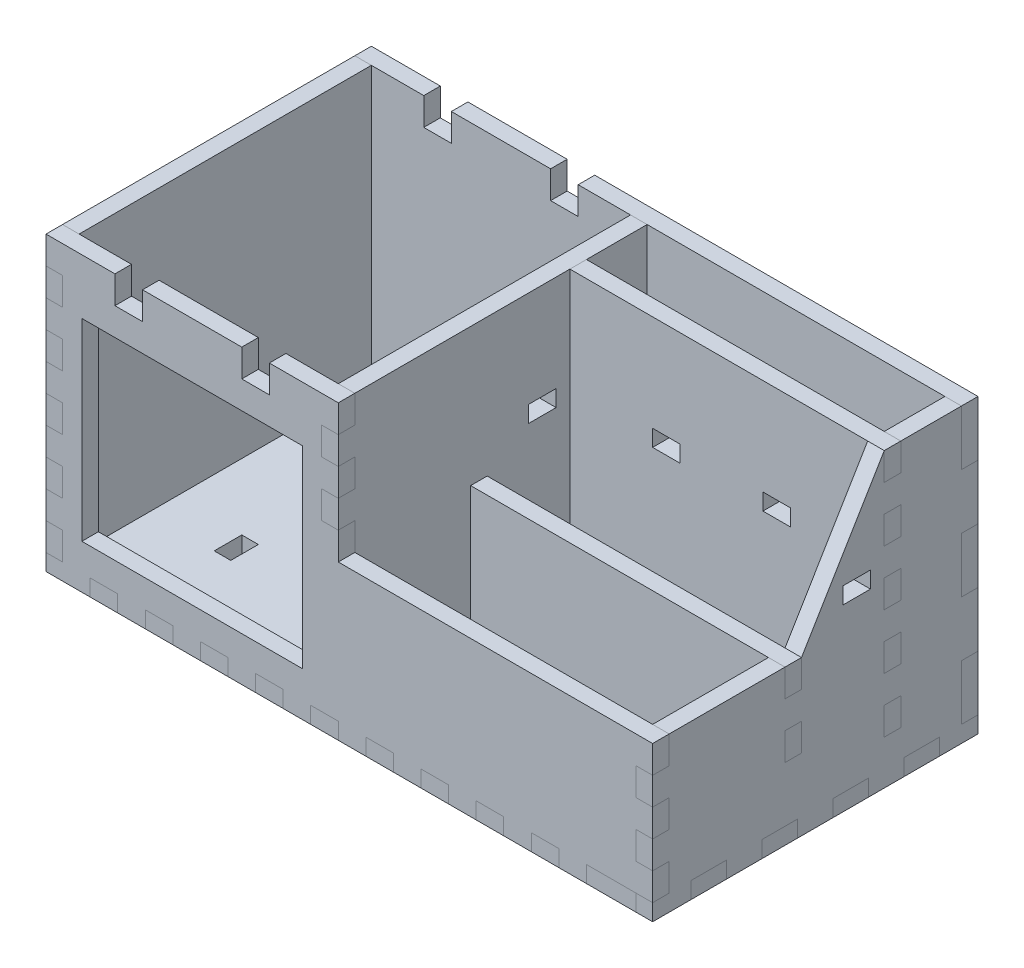
from build123d import *

# Parameters (mm, degrees)
SKETCH1_W              = 80
SKETCH1_H              = 70
BOSS_EXTRUDE1_DEPTH    = 6
SKETCH2_W              = 220
SKETCH2_H              = 118
BOSS_EXTRUDE2_DEPTH    = 6
BOSS_EXTRUDE9_DEPTH    = 6
BOSS_EXTRUDE11_DEPTH   = 6
BOSS_EXTRUDE13_DEPTH   = 6
BOSS_EXTRUDE14_DEPTH   = 6
CUT_EXTRUDE2_DEPTH     = 6
CUT_EXTRUDE1_DEPTH     = 6
CUT_EXTRUDE4_DEPTH     = 6
CUT_EXTRUDE5_DEPTH     = 6
CUT_EXTRUDE6_DEPTH     = 6
SKETCH26_W             = 108
SKETCH26_H             = 6
BOSS_EXTRUDE16_DEPTH   = 100
SKETCH28_W             = 6
SKETCH28_H             = 10
BOSS_EXTRUDE17_DEPTH   = 6
BOSS_EXTRUDE17_2_DEPTH = 6
BOSS_EXTRUDE17_3_DEPTH = 6
BOSS_EXTRUDE17_4_DEPTH = 6
BOSS_EXTRUDE17_5_DEPTH = 6
SKETCH29_W             = 6
SKETCH29_H             = 20
BOSS_EXTRUDE18_DEPTH   = 6
BOSS_EXTRUDE18_2_DEPTH = 6
SKETCH32_W             = 20
SKETCH32_H             = 6
BOSS_EXTRUDE19_DEPTH   = 6
BOSS_EXTRUDE19_2_DEPTH = 6
SKETCH34_W             = 108
SKETCH34_H             = 6
BOSS_EXTRUDE20_DEPTH   = 50
SKETCH39_W             = 6
SKETCH39_H             = 10
BOSS_EXTRUDE22_DEPTH   = 6
BOSS_EXTRUDE22_2_DEPTH = 6
SKETCH40_W             = 6
SKETCH40_H             = 20
BOSS_EXTRUDE23_DEPTH   = 6
SKETCH41_W             = 20
SKETCH41_H             = 6
BOSS_EXTRUDE24_DEPTH   = 6
BOSS_EXTRUDE24_2_DEPTH = 6
CUT_EXTRUDE9_DEPTH     = 6
SKETCH49_W             = 10
SKETCH49_H             = 6
CUT_EXTRUDE13_DEPTH    = 6
SKETCH51_W             = 10
SKETCH51_H             = 6
CUT_EXTRUDE15_DEPTH    = 6
SKETCH52_W             = 6
SKETCH52_H             = 10
CUT_EXTRUDE16_DEPTH    = 6
CUT_EXTRUDE17_DEPTH    = 6
SKETCH55_W             = 10
SKETCH55_H             = 6
CUT_EXTRUDE18_DEPTH    = 6


with BuildPart() as part:
    # Sketch1 → Boss-Extrude1 (new body)
    with BuildSketch(Plane.XY):
        Polygon((106, 106), (81, 106), (81, 96), (71, 96), (71, 106), (35, 106), (35, 96), (25, 96), (25, 106), (0, 106), (0, 96), (6, 96), (6, 86), (0, 86), (0, 76), (6, 76), (6, 66), (0, 66), (0, 56), (6, 56), (6, 46), (0, 46), (0, 36), (6, 36), (6, 26), (0, 26), (0, 16), (6, 16), (6, 6), (0, 6), (0, 0), (6, 0), (16, 0), (16, 6), (26, 6), (26, 0), (36, 0), (36, 6), (46, 6), (46, 0), (56, 0), (56, 6), (66, 6), (66, 0), (76, 0), (76, 6), (86, 6), (86, 0), (96, 0), (96, 6), (106, 6), (106, 0), (116, 0), (116, 6), (126, 6), (126, 0), (136, 0), (136, 6), (146, 6), (146, 0), (156, 0), (156, 6), (166, 6), (166, 0), (176, 0), (176, 6), (186, 6), (186, 0), (196, 0), (196, 6), (206, 6), (220, 6), (220, 16), (214, 16), (214, 26), (220, 26), (220, 36), (214, 36), (214, 46), (220, 46), (220, 56), (106, 56), (106, 66), (100, 66), (100, 76), (106, 76), (106, 86), (100, 86), (100, 96), (106, 96), align=None)
        with Locations((53, 51)):
            Rectangle(SKETCH1_W, SKETCH1_H, mode=Mode.SUBTRACT)
    extrude(amount=BOSS_EXTRUDE1_DEPTH)


with BuildPart() as body_2:
    # Sketch2 → Boss-Extrude2 (new body)
    with BuildSketch(Plane(origin=(0, 0, 0), x_dir=(1, 0, 0), z_dir=(0, 1, 0))):
        with Locations((110, 53)):
            Rectangle(SKETCH2_W, SKETCH2_H)
    extrude(amount=BOSS_EXTRUDE2_DEPTH)


with BuildPart() as body_3:
    # Sketch5 → Boss-Extrude9 (new body)
    with BuildSketch(Plane(origin=(0, 0, 0), x_dir=(0, 0, -1), z_dir=(1, 0, 0))):
        Polygon((-6, 106), (112, 106), (112, 6), (112, 0), (106, 0), (94.222222222, 0), (94.222222222, 6), (82.444444444, 6), (82.444444444, 0), (70.666666667, 0), (70.666666667, 6), (58.888888889, 6), (58.888888889, 0), (47.111111111, 0), (47.111111111, 6), (35.333333333, 6), (35.333333333, 0), (23.555555556, 0), (23.555555556, 6), (11.777777778, 6), (11.777777778, 0), (0, 0), (0, 6), (-6, 6), align=None)
    extrude(amount=BOSS_EXTRUDE9_DEPTH)


with BuildPart() as body_4:
    # Sketch11 → Boss-Extrude11 (new body)
    with BuildSketch(Plane(origin=(214, 0, 0), x_dir=(0, 0, -1), z_dir=(1, 0, 0))):
        Polygon((-6, 0), (0, 0), (8, 0), (8, 6), (20.857142857, 6), (20.857142857, 0), (33.714285714, 0), (33.714285714, 6), (46.571428571, 6), (46.571428571, 0), (59.428571429, 0), (59.428571429, 6), (72.285714286, 6), (72.285714286, 0), (85.142857143, 0), (85.142857143, 6), (98, 6), (98, 0), (112, 0), (112, 106), (78, 106), (48, 56), (-6, 56), (-6, 5.946592231), align=None)
    extrude(amount=BOSS_EXTRUDE11_DEPTH)


with BuildPart() as body_5:
    # Sketch15 → Boss-Extrude13 (new body)
    with BuildSketch(Plane(origin=(0, 0, -112), x_dir=(-1, 0, 0), z_dir=(0, 0, -1))):
        Polygon((-220, 106), (-81, 106), (-81, 96), (-71, 96), (-71, 106), (-35, 106), (-35, 96), (-25, 96), (-25, 106), (0, 106), (0, 86), (-6, 86), (-6, 66), (0, 66), (0, 46), (-6, 46), (-6, 26), (0, 26), (0, 6), (-6, 6), (-6, 0), (-24.909090909, 0), (-24.909090909, 6), (-43.818181818, 6), (-43.818181818, 0), (-62.727272727, 0), (-62.727272727, 6), (-81.636363636, 6), (-81.636363636, 0), (-100.545454545, 0), (-100.545454545, 6), (-119.454545455, 6), (-119.454545455, 0), (-138.363636364, 0), (-138.363636364, 6), (-157.272727273, 6), (-157.272727273, 0), (-176.181818182, 0), (-176.181818182, 6), (-195.090909091, 6), (-195.090909091, 0), (-214, 0), (-214, 6), (-220, 6), (-220, 26), (-214, 26), (-214, 46), (-220, 46), (-220, 66), (-214, 66), (-214, 86), (-220, 86), align=None)
    extrude(amount=-BOSS_EXTRUDE13_DEPTH)


with BuildPart() as body_6:
    # Sketch22 → Boss-Extrude14 (new body)
    with BuildSketch(Plane(origin=(100, 0, 0), x_dir=(0, 0, -1), z_dir=(1, 0, 0))):
        Polygon((-6, 106), (106, 106), (106, 86), (112, 86), (112, 66), (106, 66), (106, 46), (112, 46), (112, 26), (106, 26), (106, 6), (74, 6), (74, 0), (59, 0), (59, 6), (34, 6), (34, 0), (19, 0), (19, 6), (-6, 6), align=None)
    extrude(amount=BOSS_EXTRUDE14_DEPTH)


with BuildPart() as cut_extrude2_tool:
    # Sketch19 → Cut-Extrude2 (new body)
    with BuildSketch(Plane(origin=(0, 0, -112), x_dir=(-1, 0, 0), z_dir=(0, 0, -1))):
        Polygon((0, 86), (0, 106), (-25, 106), (-25, 96), (-35, 96), (-35, 106), (-71, 106), (-71, 96), (-81, 96), (-81, 106), (-220, 106), (-220, 86), (-214, 86), (-214, 66), (-220, 66), (-220, 46), (-214, 46), (-214, 26), (-220, 26), (-220, 6), (-214, 6), (-214, 0), (-195.090909091, 0), (-195.090909091, 6), (-176.181818182, 6), (-176.181818182, 0), (-157.272727273, 0), (-157.272727273, 6), (-138.363636364, 6), (-138.363636364, 0), (-119.454545455, 0), (-119.454545455, 6), (-100.545454545, 6), (-100.545454545, 0), (-81.636363636, 0), (-81.636363636, 6), (-62.727272727, 6), (-62.727272727, 0), (-43.818181818, 0), (-43.818181818, 6), (-24.909090909, 6), (-24.909090909, 0), (-6, 0), (-6, 6), (0, 6), (0, 26), (-6, 26), (-6, 46), (0, 46), (0, 66), (-6, 66), (-6, 86), align=None)
    extrude(amount=-CUT_EXTRUDE2_DEPTH)


with BuildPart() as body_4_1:
    add(body_4.part)

    # Cut-Extrude2: cut by cut_extrude2_tool
    add(cut_extrude2_tool.part, mode=Mode.SUBTRACT)


with BuildPart() as body_2_1:
    add(body_2.part)

    # Cut-Extrude2: cut by cut_extrude2_tool
    add(cut_extrude2_tool.part, mode=Mode.SUBTRACT)


with BuildPart() as body_3_1:
    add(body_3.part)

    # Cut-Extrude2: cut by cut_extrude2_tool
    add(cut_extrude2_tool.part, mode=Mode.SUBTRACT)


with BuildPart() as cut_extrude1_tool:
    # Sketch13 → Cut-Extrude1 (new body)
    with BuildSketch(Plane.XY.offset(6)):
        Polygon((0, 6), (0, 0), (16, 0), (16, 6), (26, 6), (26, 0), (36, 0), (36, 6), (46, 6), (46, 0), (56, 0), (56, 6), (66, 6), (66, 0), (76, 0), (76, 6), (86, 6), (86, 0), (96, 0), (96, 6), (106, 6), (106, 0), (116, 0), (116, 6), (126, 6), (126, 0), (136, 0), (136, 6), (146, 6), (146, 0), (156, 0), (156, 6), (166, 6), (166, 0), (176, 0), (176, 6), (186, 6), (186, 0), (196, 0), (196, 6), (220, 6), (220, 16), (214, 16), (214, 26), (220, 26), (220, 36), (214, 36), (214, 46), (220, 46), (220, 56), (106, 56), (106, 66), (100, 66), (100, 76), (106, 76), (106, 86), (100, 86), (100, 96), (106, 96), (106, 106), (81, 106), (81, 96), (71, 96), (71, 106), (35, 106), (35, 96), (25, 96), (25, 106), (0, 106), (0, 96), (6, 96), (6, 86), (0, 86), (0, 76), (6, 76), (6, 66), (0, 66), (0, 56), (6, 56), (6, 46), (0, 46), (0, 36), (6, 36), (6, 26), (0, 26), (0, 16), (6, 16), (6, 6), align=None)
    extrude(amount=-CUT_EXTRUDE1_DEPTH)


with BuildPart() as body_3_2:
    add(body_3_1.part)

    # Cut-Extrude1: cut by cut_extrude1_tool
    add(cut_extrude1_tool.part, mode=Mode.SUBTRACT)


with BuildPart() as body_2_2:
    add(body_2_1.part)

    # Cut-Extrude1: cut by cut_extrude1_tool
    add(cut_extrude1_tool.part, mode=Mode.SUBTRACT)

    # Sketch20 → Cut-Extrude4 (cut)
    with BuildSketch(Plane.ZY):
        Polygon((-112, 26), (-106, 26), (-106, 6), (-112, 6), (-112, 0), (-94.222222222, 0), (-94.222222222, 6), (-82.444444444, 6), (-82.444444444, 0), (-70.666666667, 0), (-70.666666667, 6), (-58.888888889, 6), (-58.888888889, 0), (-47.111111111, 0), (-47.111111111, 6), (-35.333333333, 6), (-35.333333333, 0), (-23.555555556, 0), (-23.555555556, 6), (-11.777777778, 6), (-11.777777778, 0), (0, 0), (0, 6), (6, 6), (6, 16), (0, 16), (0, 26), (6, 26), (6, 36), (0, 36), (0, 46), (6, 46), (6, 56), (0, 56), (0, 66), (6, 66), (6, 76), (0, 76), (0, 86), (6, 86), (6, 96), (0, 96), (0, 106), (-106, 106), (-106, 86), (-112, 86), (-112, 66), (-106, 66), (-106, 46), (-112, 46), align=None)
    extrude(amount=-CUT_EXTRUDE4_DEPTH, mode=Mode.SUBTRACT)

    # Sketch21 → Cut-Extrude5 (cut)
    with BuildSketch(Plane(origin=(220, 0, 0), x_dir=(0, 0, -1), z_dir=(1, 0, 0))):
        Polygon((112, 86), (106, 86), (106, 106), (78, 106), (48, 56), (0, 56), (0, 46), (-6, 46), (-6, 36), (0, 36), (0, 26), (-6, 26), (-6, 16), (0, 16), (0, 6), (-6, 6), (-6, 0), (8, 0), (8, 6), (20.857142857, 6), (20.857142857, 0), (33.714285714, 0), (33.714285714, 6), (46.571428571, 6), (46.571428571, 0), (59.428571429, 0), (59.428571429, 6), (72.285714286, 6), (72.285714286, 0), (85.142857143, 0), (85.142857143, 6), (98, 6), (98, 0), (112, 0), (112, 6), (106, 6), (106, 26), (112, 26), (112, 46), (106, 46), (106, 66), (112, 66), align=None)
    extrude(amount=-CUT_EXTRUDE5_DEPTH, mode=Mode.SUBTRACT)


with BuildPart() as body_4_2:
    add(body_4_1.part)

    # Cut-Extrude1: cut by cut_extrude1_tool
    add(cut_extrude1_tool.part, mode=Mode.SUBTRACT)


with BuildPart() as body_6_1:
    add(body_6.part)

    # Cut-Extrude1: cut by cut_extrude1_tool
    add(cut_extrude1_tool.part, mode=Mode.SUBTRACT)


with BuildPart() as cut_extrude6_tool:
    # Sketch23 → Cut-Extrude6 (new body)
    with BuildSketch(Plane(origin=(106, 0, 0), x_dir=(0, 0, -1), z_dir=(1, 0, 0))):
        Polygon((0, 96), (-6, 96), (-6, 86), (0, 86), (0, 76), (-6, 76), (-6, 66), (0, 66), (0, 6), (19, 6), (19, 0), (34, 0), (34, 6), (59, 6), (59, 0), (74, 0), (74, 6), (106, 6), (106, 26), (112, 26), (112, 46), (106, 46), (106, 66), (112, 66), (112, 86), (106, 86), (106, 106), (0, 106), align=None)
    extrude(amount=-CUT_EXTRUDE6_DEPTH)


with BuildPart() as body_2_3:
    add(body_2_2.part)

    # Cut-Extrude6: cut by cut_extrude6_tool
    add(cut_extrude6_tool.part, mode=Mode.SUBTRACT)


with BuildPart() as body_5_1:
    add(body_5.part)

    # Cut-Extrude6: cut by cut_extrude6_tool
    add(cut_extrude6_tool.part, mode=Mode.SUBTRACT)


with BuildPart() as body_7:
    # Sketch26 → Boss-Extrude16 (new body)
    with BuildSketch(Plane(origin=(0, 6, 0), x_dir=(1, 0, 0), z_dir=(0, 1, 0))):
        with Locations((160, 81)):
            Rectangle(SKETCH26_W, SKETCH26_H)
    extrude(amount=BOSS_EXTRUDE16_DEPTH)


with BuildPart() as body_8:
    # Sketch28 → Boss-Extrude17 (new body)
    with BuildSketch(Plane(origin=(214, 0, 0), x_dir=(0, 0, -1), z_dir=(1, 0, 0))):
        with Locations((81, 81)):
            Rectangle(SKETCH28_W, SKETCH28_H)
    extrude(amount=BOSS_EXTRUDE17_DEPTH)


with BuildPart() as body_9:
    # Sketch28 → Boss-Extrude17 2 (new body)
    with BuildSketch(Plane(origin=(214, 0, 0), x_dir=(0, 0, -1), z_dir=(1, 0, 0))):
        with Locations((81, 61)):
            Rectangle(SKETCH28_W, SKETCH28_H)
    extrude(amount=BOSS_EXTRUDE17_2_DEPTH)


with BuildPart() as body_10:
    # Sketch28 → Boss-Extrude17 3 (new body)
    with BuildSketch(Plane(origin=(214, 0, 0), x_dir=(0, 0, -1), z_dir=(1, 0, 0))):
        with Locations((81, 101)):
            Rectangle(SKETCH28_W, SKETCH28_H)
    extrude(amount=BOSS_EXTRUDE17_3_DEPTH)


with BuildPart() as body_11:
    # Sketch28 → Boss-Extrude17 4 (new body)
    with BuildSketch(Plane(origin=(214, 0, 0), x_dir=(0, 0, -1), z_dir=(1, 0, 0))):
        with Locations((81, 41)):
            Rectangle(SKETCH28_W, SKETCH28_H)
    extrude(amount=BOSS_EXTRUDE17_4_DEPTH)


with BuildPart() as body_12:
    # Sketch28 → Boss-Extrude17 5 (new body)
    with BuildSketch(Plane(origin=(214, 0, 0), x_dir=(0, 0, -1), z_dir=(1, 0, 0))):
        with Locations((81, 21)):
            Rectangle(SKETCH28_W, SKETCH28_H)
    extrude(amount=BOSS_EXTRUDE17_5_DEPTH)


with BuildPart() as body_7_1:
    add(body_7.part)

    # Combine1: union body 10, body 8, body 9, body 11, body 12
    add(body_10.part)
    add(body_8.part)
    add(body_9.part)
    add(body_11.part)
    add(body_12.part)


with BuildPart() as body_8_2:
    # Sketch29 → Boss-Extrude18 (new body)
    with BuildSketch(Plane.ZY.offset(-106)):
        with Locations((-81, 38.975792387)):
            Rectangle(SKETCH29_W, SKETCH29_H)
    extrude(amount=BOSS_EXTRUDE18_DEPTH)


with BuildPart() as body_9_2:
    # Sketch29 → Boss-Extrude18 2 (new body)
    with BuildSketch(Plane.ZY.offset(-106)):
        with Locations((-81, 82.881646171)):
            Rectangle(SKETCH29_W, SKETCH29_H)
    extrude(amount=BOSS_EXTRUDE18_2_DEPTH)


with BuildPart() as body_10_2:
    # Sketch32 → Boss-Extrude19 (new body)
    with BuildSketch(Plane.XZ.offset(-6)):
        with Locations((179.166556654, -81)):
            Rectangle(SKETCH32_W, SKETCH32_H)
    extrude(amount=BOSS_EXTRUDE19_DEPTH)


with BuildPart() as body_11_2:
    # Sketch32 → Boss-Extrude19 2 (new body)
    with BuildSketch(Plane.XZ.offset(-6)):
        with Locations((139.166556654, -81)):
            Rectangle(SKETCH32_W, SKETCH32_H)
    extrude(amount=BOSS_EXTRUDE19_2_DEPTH)

    # Combine3: union body 10 2, body 7, body 8 2
    add(body_10_2.part)
    add(body_7_1.part)
    add(body_8_2.part)

    # Sketch51 → Cut-Extrude15 (cut)
    with BuildSketch(Plane.XY.offset(-78)):
        with Locations((141, 68)):
            Rectangle(SKETCH51_W, SKETCH51_H)
        with Locations((181, 68)):
            Rectangle(SKETCH51_W, SKETCH51_H)
    extrude(amount=-CUT_EXTRUDE15_DEPTH, mode=Mode.SUBTRACT)


with BuildPart() as body_9_3:
    # Sketch34 → Boss-Extrude20 (new body)
    with BuildSketch(Plane(origin=(0, 6, 0), x_dir=(1, 0, 0), z_dir=(0, 1, 0))):
        with Locations((160, 45)):
            Rectangle(SKETCH34_W, SKETCH34_H)
    extrude(amount=BOSS_EXTRUDE20_DEPTH)


with BuildPart() as body_10_3:
    # Sketch39 → Boss-Extrude22 (new body)
    with BuildSketch(Plane(origin=(214, 0, 0), x_dir=(0, 0, -1), z_dir=(1, 0, 0))):
        with Locations((45, 51)):
            Rectangle(SKETCH39_W, SKETCH39_H)
    extrude(amount=BOSS_EXTRUDE22_DEPTH)


with BuildPart() as body_11_3:
    # Sketch39 → Boss-Extrude22 2 (new body)
    with BuildSketch(Plane(origin=(214, 0, 0), x_dir=(0, 0, -1), z_dir=(1, 0, 0))):
        with Locations((45, 31)):
            Rectangle(SKETCH39_W, SKETCH39_H)
    extrude(amount=BOSS_EXTRUDE22_2_DEPTH)


with BuildPart() as body_12_2:
    # Sketch40 → Boss-Extrude23 (new body)
    with BuildSketch(Plane.ZY.offset(-106)):
        with Locations((-45, 31)):
            Rectangle(SKETCH40_W, SKETCH40_H)
    extrude(amount=BOSS_EXTRUDE23_DEPTH)


with BuildPart() as body_13:
    # Sketch41 → Boss-Extrude24 (new body)
    with BuildSketch(Plane.XZ.offset(-6)):
        with Locations((140.233640548, -45)):
            Rectangle(SKETCH41_W, SKETCH41_H)
    extrude(amount=BOSS_EXTRUDE24_DEPTH)


with BuildPart() as body_14:
    # Sketch41 → Boss-Extrude24 2 (new body)
    with BuildSketch(Plane.XZ.offset(-6)):
        with Locations((180.233640548, -45)):
            Rectangle(SKETCH41_W, SKETCH41_H)
    extrude(amount=BOSS_EXTRUDE24_2_DEPTH)


with BuildPart() as body_9_3_1:
    add(body_9_3.part)

    # Combine4: union body 11 3, body 10 3, body 14, body 13, body 12 2
    add(body_11_3.part)
    add(body_10_3.part)
    add(body_14.part)
    add(body_13.part)
    add(body_12_2.part)


with BuildPart() as cut_extrude9_tool:
    # Sketch42 → Cut-Extrude9 (new body)
    with BuildSketch(Plane.XY.offset(-42)):
        Polygon((106, 6), (130.233640548, 6), (130.233640548, 0), (150.233640548, 0), (150.233640548, 6), (170.233640548, 6), (170.233640548, 0), (190.233640548, 0), (190.233640548, 6), (214, 6), (214, 26), (220, 26), (220, 36), (214, 36), (214, 46), (220, 46), (220, 56), (106, 56), (106, 41), (100, 41), (100, 21), (106, 21), align=None)
    extrude(amount=-CUT_EXTRUDE9_DEPTH)


with BuildPart() as body_4_3:
    add(body_4_2.part)

    # Cut-Extrude9: cut by cut_extrude9_tool
    add(cut_extrude9_tool.part, mode=Mode.SUBTRACT)


with BuildPart() as body_2_4:
    add(body_2_3.part)

    # Cut-Extrude9: cut by cut_extrude9_tool
    add(cut_extrude9_tool.part, mode=Mode.SUBTRACT)

    # Sketch52 → Cut-Extrude16 (cut)
    with BuildSketch(Plane.XZ):
        with Locations((33, -30)):
            Rectangle(SKETCH52_W, SKETCH52_H)
        with Locations((33, -75)):
            Rectangle(SKETCH52_W, SKETCH52_H)
        with Locations((74, -30)):
            Rectangle(SKETCH52_W, SKETCH52_H)
        with Locations((74, -75)):
            Rectangle(SKETCH52_W, SKETCH52_H)
    extrude(amount=-CUT_EXTRUDE16_DEPTH, mode=Mode.SUBTRACT)


with BuildPart() as body_6_2:
    add(body_6_1.part)

    # Cut-Extrude9: cut by cut_extrude9_tool
    add(cut_extrude9_tool.part, mode=Mode.SUBTRACT)

    # Sketch49 → Cut-Extrude13 (cut)
    with BuildSketch(Plane(origin=(106, 0, 0), x_dir=(0, 0, -1), z_dir=(1, 0, 0))):
        with Locations((68, 68)):
            Rectangle(SKETCH49_W, SKETCH49_H)
    extrude(amount=-CUT_EXTRUDE13_DEPTH, mode=Mode.SUBTRACT)


with BuildPart() as cut_extrude17_tool:
    # Sketch53 → Cut-Extrude17 (new body)
    with BuildSketch(Plane.XY.offset(-78)):
        Polygon((149.166556654, 0), (149.166556654, 6), (169.166556654, 6), (169.166556654, 0), (189.166556654, 0), (189.166556654, 6), (214, 6), (214, 16), (220, 16), (220, 26), (214, 26), (214, 36), (220, 36), (220, 46), (214, 46), (214, 56), (220, 56), (220, 66), (214, 66), (214, 76), (220, 76), (220, 86), (214, 86), (214, 96), (220, 96), (220, 106), (106, 106), (106, 48.975792387), (100, 48.975792387), (100, 28.975792387), (106, 28.975792387), (106, 6), (129.166556654, 6), (129.166556654, 0), align=None)
    extrude(amount=-CUT_EXTRUDE17_DEPTH)


with BuildPart() as body_6_3:
    add(body_6_2.part)

    # Cut-Extrude17: cut by cut_extrude17_tool
    add(cut_extrude17_tool.part, mode=Mode.SUBTRACT)


with BuildPart() as body_4_4:
    add(body_4_3.part)

    # Cut-Extrude17: cut by cut_extrude17_tool
    add(cut_extrude17_tool.part, mode=Mode.SUBTRACT)

    # Sketch55 → Cut-Extrude18 (cut)
    with BuildSketch(Plane(origin=(220, 0, 0), x_dir=(0, 0, -1), z_dir=(1, 0, 0))):
        with Locations((68, 68)):
            Rectangle(SKETCH55_W, SKETCH55_H)
    extrude(amount=-CUT_EXTRUDE18_DEPTH, mode=Mode.SUBTRACT)


with BuildPart() as body_2_5:
    add(body_2_4.part)

    # Cut-Extrude17: cut by cut_extrude17_tool
    add(cut_extrude17_tool.part, mode=Mode.SUBTRACT)


solid = Compound([part.part, body_3_2.part, body_5_1.part, body_9_2.part, body_11_2.part, body_9_3_1.part, body_6_3.part, body_4_4.part, body_2_5.part])
